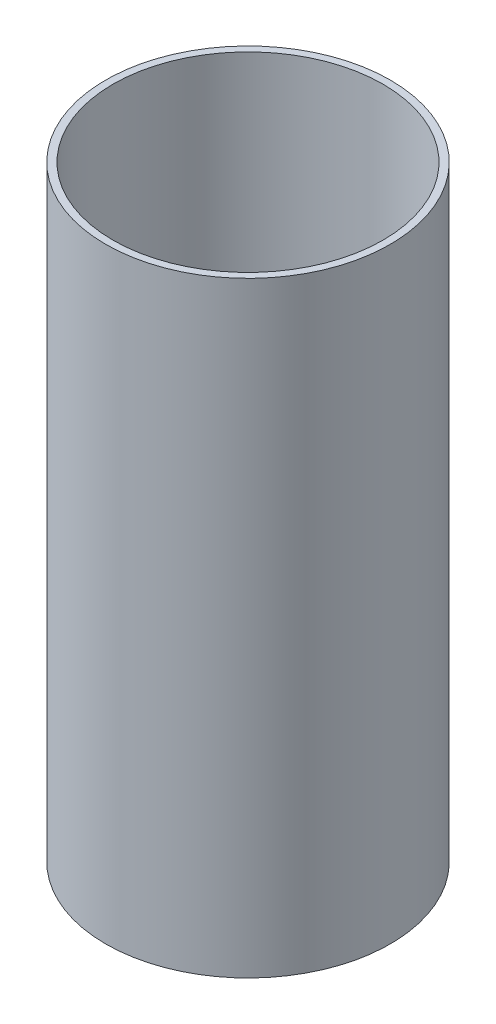
from build123d import *

# Parameters (mm, degrees)
SKETCH1_R           = 93.6625
SKETCH1_R_2         = 88.9
BOSS_EXTRUDE1_DEPTH = 199.39


with BuildPart() as part:
    # Sketch1 → Boss-Extrude1 (new, symmetric)
    with BuildSketch(Plane(origin=(0, 0, 0), x_dir=(1, 0, 0), z_dir=(0, 1, 0))):
        Circle(SKETCH1_R)
        Circle(SKETCH1_R_2, mode=Mode.SUBTRACT)
    extrude(amount=BOSS_EXTRUDE1_DEPTH, both=True)


solid = part.part
